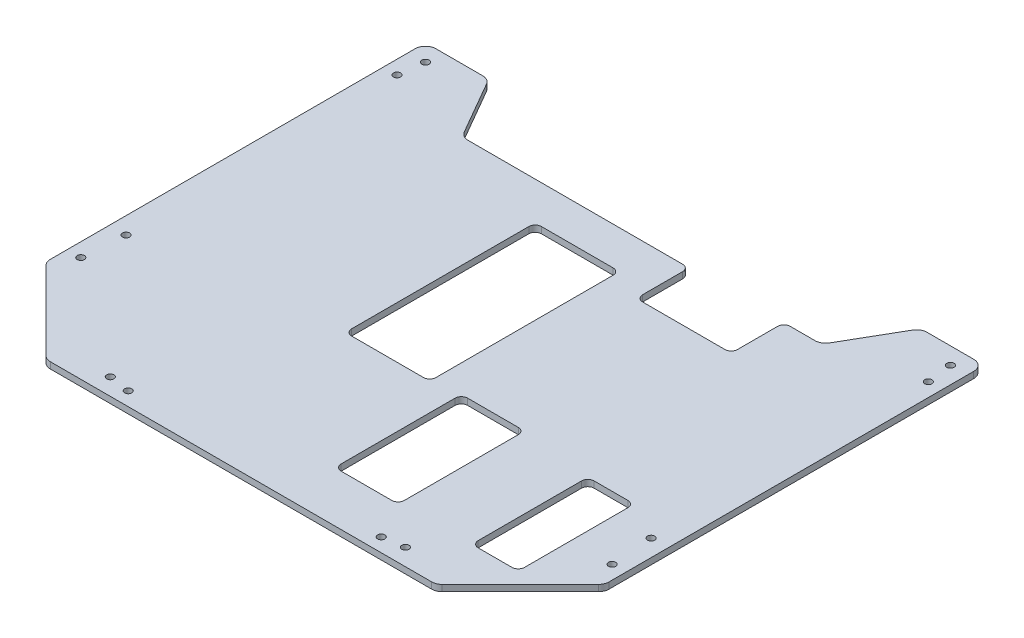
from build123d import *

# Parameters (mm, degrees)
BOSS_EXTRU_1_DEPTH      = 3
CONG_1_R                = 5
ESQUISSE2_R             = 1
ESQUISSE2_R_2           = 1.5
ENL_V_MAT_EXTRU_1_DEPTH = 257.837010573
D_GAGEMENT_M31_D        = 3.4
ESQUISSE5_W             = 45
ESQUISSE5_H             = 25
ESQUISSE5_W_2           = 40
ESQUISSE5_H_2           = 90
ESQUISSE5_W_3           = 22
ESQUISSE5_H_3           = 55
ESQUISSE5_W_4           = 30
ESQUISSE5_H_4           = 60
ENL_V_MAT_EXTRU_2_DEPTH = 257.837010573
CONG_2_R                = 3


with BuildPart() as part:
    # Esquisse1 → Boss.-Extru.1 (new body)
    with BuildSketch(Plane(origin=(0, 0, 0), x_dir=(1, 0, 0), z_dir=(0, 1, 0))):
        Polygon((-92.5, 0), (92.5, 0), (132.5, 40), (132.5, 220), (102.5, 220), (85.179491924, 190), (-85.179491924, 190), (-102.5, 220), (-132.5, 220), (-132.5, 40), align=None)
    extrude(amount=BOSS_EXTRU_1_DEPTH)

    # Congé1
    cong_1_edges = [part.edges().sort_by_distance(p)[0] for p in [
        (132.5, 1.5, -220),
        (102.5, 1.5, -220),
        (85.179491924, 1.5, -190),
        (-85.179491924, 1.5, -190),
        (-102.5, 1.5, -220),
        (-132.5, 1.5, -220),
        (-132.5, 1.5, -40),
        (-92.5, 1.5, 0),
        (92.5, 1.5, 0),
        (132.5, 1.5, -40),
    ]]
    fillet(cong_1_edges, radius=CONG_1_R)

    # Esquisse2 → Enlèv. mat.-Extru.1 (cut, through all)
    with BuildSketch(Plane.XZ):
        with Locations((-70, -8)):
            Circle(ESQUISSE2_R)
        with Locations((-124.5, -70)):
            Circle(ESQUISSE2_R)
        with Locations((-124.5, -212)):
            Circle(ESQUISSE2_R)
        with Locations((124.5, -212)):
            Circle(ESQUISSE2_R)
        with Locations((124.5, -70)):
            Circle(ESQUISSE2_R)
        with Locations((70, -8)):
            Circle(ESQUISSE2_R)
        with Locations((126, -50)):
            Circle(ESQUISSE2_R_2)
        with Locations((126, -200)):
            Circle(ESQUISSE2_R_2)
        with Locations((-60, -6.5)):
            Circle(ESQUISSE2_R_2)
        with Locations((60, -6.5)):
            Circle(ESQUISSE2_R_2)
        with Locations((-126, -50)):
            Circle(ESQUISSE2_R_2)
        with Locations((-126, -200)):
            Circle(ESQUISSE2_R_2)
    extrude(amount=-ENL_V_MAT_EXTRU_1_DEPTH, mode=Mode.SUBTRACT)

    # Dégagement M31 (through all)
    with Locations(Plane(origin=(0, 0, 0), x_dir=(-1, 0, 0), z_dir=(0, -1, 0))):
        with Locations((-70, 8), (-124.5, 70), (-124.5, 212), (124.5, 212), (124.5, 70), (70, 8), (-126, 200), (-126, 50), (-60, 6.5), (60, 6.5), (126, 50), (126, 200)):
            Hole(D_GAGEMENT_M31_D / 2)

    # Esquisse5 → Enlèv. mat.-Extru.2 (cut, through all)
    with BuildSketch(Plane.XZ):
        with Locations((45, -177.5)):
            Rectangle(ESQUISSE5_W, ESQUISSE5_H)
        with Locations((-12.5, -127)):
            Rectangle(ESQUISSE5_W_2, ESQUISSE5_H_2)
        with Locations((95.5, -52.5)):
            Rectangle(ESQUISSE5_W_3, ESQUISSE5_H_3)
        with Locations((35.5, -54)):
            Rectangle(ESQUISSE5_W_4, ESQUISSE5_H_4)
    extrude(amount=-ENL_V_MAT_EXTRU_2_DEPTH, mode=Mode.SUBTRACT)

    # Congé2
    cong_2_edges = [part.edges().sort_by_distance(p)[0] for p in [
        (67.5, 1.5, -190),
        (67.5, 1.5, -165),
        (22.5, 1.5, -165),
        (22.5, 1.5, -190),
        (106.5, 1.5, -80),
        (84.5, 1.5, -80),
        (84.5, 1.5, -25),
        (106.5, 1.5, -25),
        (7.5, 1.5, -82),
        (7.5, 1.5, -172),
        (-32.5, 1.5, -82),
        (-32.5, 1.5, -172),
        (50.5, 1.5, -84),
        (20.5, 1.5, -84),
        (50.5, 1.5, -24),
        (20.5, 1.5, -24),
    ]]
    fillet(cong_2_edges, radius=CONG_2_R)


solid = part.part
